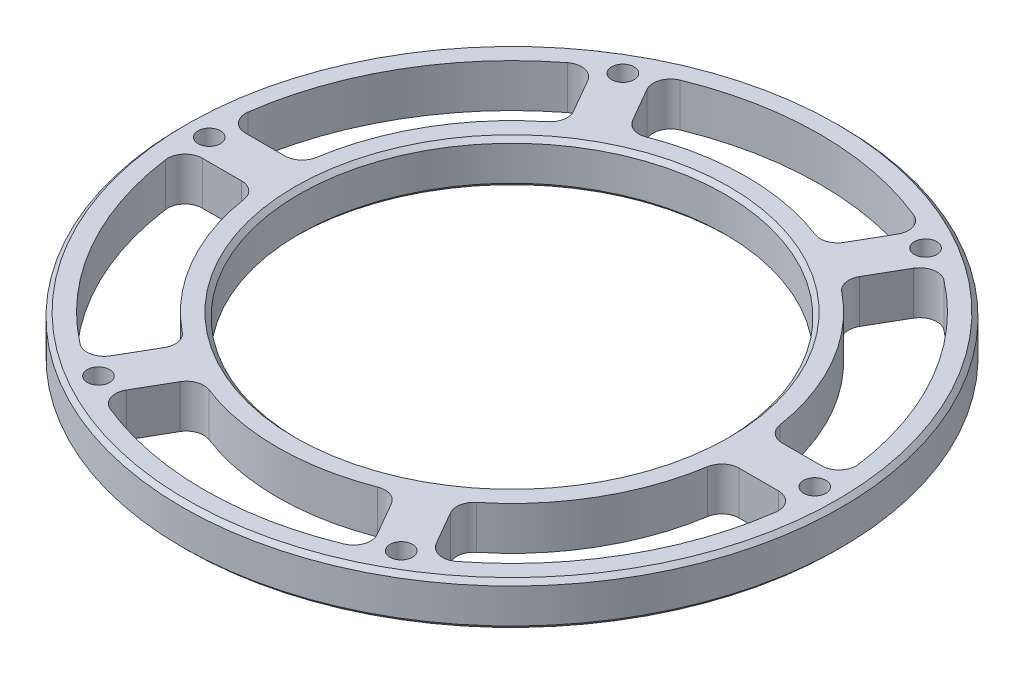
from build123d import *

# Parameters (mm, degrees)
SKETCH2_W                  = 26.9875
SKETCH2_H                  = 10
F_6_0_204_DIAMETER_HOLE1_D = 5.1816
CIRPATTERN3_COUNT          = 6
CUT_EXTRUDE1_DEPTH         = 109.226059708
FILLET1_R                  = 4
CIRPATTERN4_COUNT          = 6
FILLET1_OF_CIRPATTERN4_R   = 4
CHAMFER1_SIZE              = 1
CHAMFER2_SIZE              = 1


with BuildPart() as part:
    # Sketch2 → Revolve1 (revolve)
    with BuildSketch(Plane(origin=(0, 0, 0), x_dir=(0, 0, -1), z_dir=(1, 0, 0))):
        with Locations((-62.70625, 5)):
            Rectangle(SKETCH2_W, SKETCH2_H)
    revolve(axis=Axis((0, -0.5, 0), (0, 1, 0)))

    # #6 (0.204) Diameter Hole1 (through all)
    with Locations(Plane(origin=(0, 10, 0), x_dir=(1, 0, 0), z_dir=(0, 1, 0))):
        with Locations((-35, 60.621778265)):
            f_6_0_204_diameter_hole1 = Hole(F_6_0_204_DIAMETER_HOLE1_D / 2)

    # CirPattern3: #6 (0.204) Diameter Hole1 ×6 about axis
    cirpattern3_axis = Axis((0, -0.5, 0), (0, 1, 0))
    for i in range(1, CIRPATTERN3_COUNT):
        add(f_6_0_204_diameter_hole1.rotate(cirpattern3_axis, i * 360 / CIRPATTERN3_COUNT), mode=Mode.SUBTRACT)

    # Sketch8 → Cut-Extrude1 (cut, through all)
    with BuildSketch(Plane(origin=(0, 10, 0), x_dir=(1, 0, 0), z_dir=(0, 1, 0))):
        with BuildLine():
            Line((-22.660589701, 49.249292692), (-31.181983591, 64.008779861))
            ThreePointArc((-31.181983591, 64.008779861), (0, 71.2), (31.181983591, 64.008779861))
            Line((31.181983591, 64.008779861), (22.660589701, 49.249292692))
            ThreePointArc((22.660589701, 49.249292692), (0, 54.2125), (-22.660589701, 49.249292692))
        make_face()
    cut_extrude1 = extrude(amount=-CUT_EXTRUDE1_DEPTH, mode=Mode.SUBTRACT)

    # Fillet1
    fillet1_edges = [part.edges().sort_by_distance(p)[0] for p in [
        (-22.660589701, 5, -49.249292692),
        (22.660589701, 5, -49.249292692),
        (31.181983591, 5, -64.008779861),
        (-31.181983591, 5, -64.008779861),
    ]]
    fillet(fillet1_edges, radius=FILLET1_R)

    # CirPattern4: Cut-Extrude1 ×6 about axis
    cirpattern4_axis = Axis((0, -0.5, 0), (0, 1, 0))
    for i in range(1, CIRPATTERN4_COUNT):
        add(cut_extrude1.rotate(cirpattern4_axis, i * 360 / CIRPATTERN4_COUNT), mode=Mode.SUBTRACT)

    # Fillet1 of CirPattern4
    fillet1_of_cirpattern4_edges = [part.edges().sort_by_distance(p)[0] for p in [
        (-53.98143344, 5, -5),
        (-31.320843739, 5, -44.249292692),
        (-39.842237629, 5, -59.008779861),
        (-71.024221221, 5, -5),
        (-31.320843739, 5, 44.249292692),
        (-53.98143344, 5, 5),
        (-71.024221221, 5, 5),
        (-39.842237629, 5, 59.008779861),
        (22.660589701, 5, 49.249292692),
        (-22.660589701, 5, 49.249292692),
        (-31.181983591, 5, 64.008779861),
        (31.181983591, 5, 64.008779861),
        (53.98143344, 5, 5),
        (31.320843739, 5, 44.249292692),
        (39.842237629, 5, 59.008779861),
        (71.024221221, 5, 5),
        (31.320843739, 5, -44.249292692),
        (53.98143344, 5, -5),
        (71.024221221, 5, -5),
        (39.842237629, 5, -59.008779861),
    ]]
    fillet(fillet1_of_cirpattern4_edges, radius=FILLET1_OF_CIRPATTERN4_R)

    # Chamfer1
    chamfer1_edges = [part.edges().sort_by_distance(p)[0] for p in [
        (0, 10, -49.2125),
        (0, 0, -49.2125),
    ]]
    chamfer(chamfer1_edges, length=CHAMFER1_SIZE)

    # Chamfer2
    chamfer2_edges = [part.edges().sort_by_distance(p)[0] for p in [
        (0, 10, -76.2),
        (0, 0, -76.2),
    ]]
    chamfer(chamfer2_edges, length=CHAMFER2_SIZE)


solid = part.part
